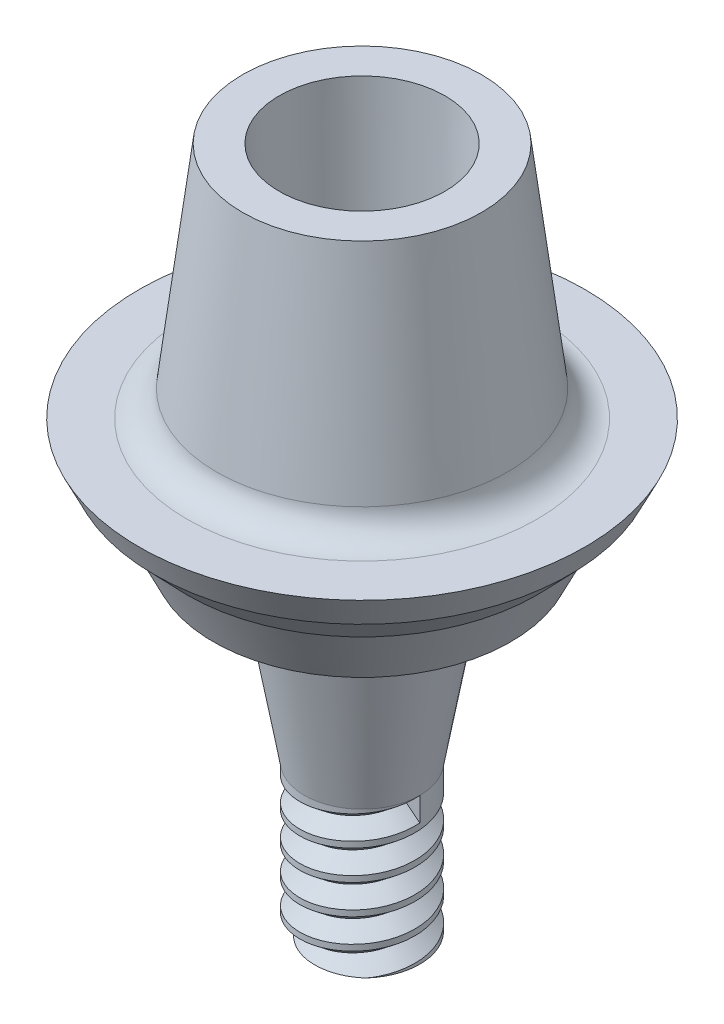
from build123d import *
from build123d.topology import SkipClean

# Parameters (mm, degrees)
ESQUISSE4_W                           = 3.292935648
ESQUISSE4_H                           = 1.153716838
ENL_VEMENT_DE_MATI_RE_BALAYAGE1_PITCH = 1


with BuildPart() as part:
    # Esquisse1 → Révolution1 (revolve)
    with BuildSketch(Plane.XY, mode=Mode.PRIVATE) as r_volution1_sk:
        with BuildLine():
            Line((-3, 0), (-1.942038116, -6))
            Line((-1.942038116, -6), (-1.942038116, -11))
            Line((-1.942038116, -11), (0, -11))
            Line((0, -11), (0, 0))
            Line((0, 0), (0, 2))
            Line((0, 2), (0, 4.014732825))
            Line((0, 4.014732825), (-2.5, 4.014732825))
            Line((-2.5, 4.014732825), (-2.786908966, 12.014732825))
            Line((-2.786908966, 12.014732825), (-4.017723513, 12.014732825))
            Line((-4.017723513, 12.014732825), (-4.892179113, 4.892863482))
            ThreePointArc((-4.892179113, 4.892863482), (-5.222105216, 4.265777105), (-5.884725265, 4.014732825))
            Line((-5.884725265, 4.014732825), (-7.5, 4.014732825))
            Line((-7.5, 4.014732825), (-6.984656758, 2.95091606))
            Line((-6.984656758, 2.95091606), (-5.86881956, 1.793493615))
            Line((-5.86881956, 1.793493615), (-5, 0))
            Line((-5, 0), (-3, 0))
        make_face()
    revolve(r_volution1_sk.sketch.rotate(Axis((0, -11, 0), (0, 1, 0)), 270), axis=Axis((0, -11, 0), (0, 1, 0)))

    # Esquisse4 → Enlèvement de matière-Révolution1 (revolve, cut)
    with BuildSketch(Plane.XY, mode=Mode.PRIVATE) as enl_vement_de_mati_re_r_volution1_sk:
        with Locations((1.646467824, -11.493285508)):
            Rectangle(ESQUISSE4_W, ESQUISSE4_H)
    revolve(enl_vement_de_mati_re_r_volution1_sk.sketch.rotate(Axis((0, -10.860421417, 0), (0, -1, 0)), 270), axis=Axis((0, -10.860421417, 0), (0, -1, 0)), mode=Mode.SUBTRACT)

    # Enlèvement de matière-Balayage1: the profile of Esquisse3 profile screwed along a right-hand helix of 5 turns, 8 arcs to a turn; built about Z, then put on its axis
    with SkipClean():  # the faces are left unmerged after this step: merging them gives an invalid solid
        enl_vement_de_mati_re_balayage1_z = Axis((0, 0, 0), (0, 0, 1))
        enl_vement_de_mati_re_balayage1_corners = [(1.942338116, 0, -0.00024), (1.942338116, 0, 0.80024), (1.442038116, 0, 0.4)]
        with BuildLine(mode=Mode.PRIVATE) as enl_vement_de_mati_re_balayage1_profile:
            Line(enl_vement_de_mati_re_balayage1_corners[0], enl_vement_de_mati_re_balayage1_corners[1])
            Line(enl_vement_de_mati_re_balayage1_corners[1], enl_vement_de_mati_re_balayage1_corners[2])
            Line(enl_vement_de_mati_re_balayage1_corners[2], enl_vement_de_mati_re_balayage1_corners[0])
        enl_vement_de_mati_re_balayage1_cap = Face(enl_vement_de_mati_re_balayage1_profile.wire())
        enl_vement_de_mati_re_balayage1_turn_angles = [0, 22.5, 45, 67.5, 90, 112.5, 135, 157.5, 180, 202.5, 225, 247.5, 270, 292.5, 315, 337.5, 360]
        enl_vement_de_mati_re_balayage1_turn_weights = [1, 0.9238795325112867, 1, 0.9238795325112867, 1, 0.9238795325112867, 1, 0.9238795325112867, 1, 0.9238795325112867, 1, 0.9238795325112867, 1, 0.9238795325112867, 1, 0.9238795325112867, 1]
        enl_vement_de_mati_re_balayage1_turn_rails = [Edge.make_bspline([Vector(p[0], p[1], 0).rotate(enl_vement_de_mati_re_balayage1_z, enl_vement_de_mati_re_balayage1_turn_angles[k]) / enl_vement_de_mati_re_balayage1_turn_weights[k] + Vector(0, 0, p[2] + ENL_VEMENT_DE_MATI_RE_BALAYAGE1_PITCH * enl_vement_de_mati_re_balayage1_turn_angles[k] / 360) for k in range(17)], [0, 0, 0, 1, 1, 2, 2, 3, 3, 4, 4, 5, 5, 6, 6, 7, 7, 8, 8, 8], 2, enl_vement_de_mati_re_balayage1_turn_weights) for p in enl_vement_de_mati_re_balayage1_corners]
        enl_vement_de_mati_re_balayage1_turn_sides = [Face.make_surface_from_curves(enl_vement_de_mati_re_balayage1_turn_rails[p[0]], enl_vement_de_mati_re_balayage1_turn_rails[p[1]]) for p in [(0, 1), (1, 2), (2, 0)]]
        enl_vement_de_mati_re_balayage1 = Plane(origin=(0, -6, 0), x_dir=(1, 0, 0), z_dir=(0, -1, 0)) * Solid(Shell([*[p.moved(Location((0, 0, ENL_VEMENT_DE_MATI_RE_BALAYAGE1_PITCH * i))) for i in range(5) for p in enl_vement_de_mati_re_balayage1_turn_sides], enl_vement_de_mati_re_balayage1_cap, enl_vement_de_mati_re_balayage1_cap.rotate(enl_vement_de_mati_re_balayage1_z, 1800).moved(Location((0, 0, ENL_VEMENT_DE_MATI_RE_BALAYAGE1_PITCH * 1800 / 360)))]))
        add(enl_vement_de_mati_re_balayage1, mode=Mode.SUBTRACT)


solid = part.part
